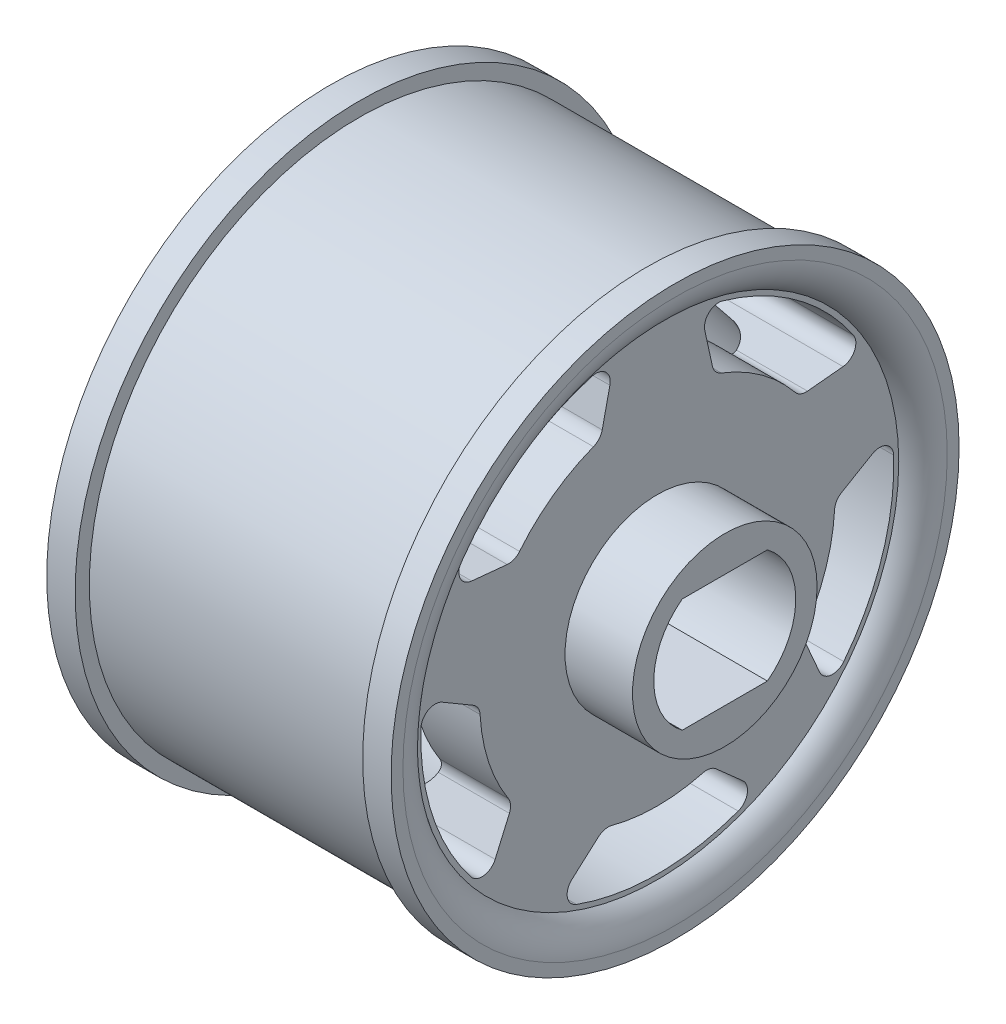
from build123d import *

# Parameters (mm, degrees)
CUT_EXTRUDE1_DEPTH      = 40.624014183
CUT_EXTRUDE2_DEPTH      = 34.660993746
CUT_EXTRUDE2_DEPTH_BACK = 34.660993746
FILLET2_R               = 1


with BuildPart() as part:
    # Sketch1 → Revolve1 (revolve)
    with BuildSketch(Plane(origin=(0, 0, 0), x_dir=(1, 0, 0), z_dir=(0, 1, 0))):
        Polygon((0, 0), (0, 6.5), (-4.75, 6.5), (-4.75, 17), (-3.5, 17), (-3.5, 20), (-5.5, 20), (-5.5, 19), (-25.75, 19), (-25.75, 20), (-27.75, 20), (-27.75, 17), (-9.5, 14), (-9.5, 0), align=None)
    revolve(axis=Axis((0, 0, 0), (-1, 0, 0)))

    # Fillet1: read off the stored shape, not the designer's step
    # Fillet1 outline → Fillet1 (revolve, cut)
    with BuildSketch(Plane.YX):
        with BuildLine():
            Line((16.655701343, -25.655516501), (16.655701343, -27.75))
            Line((16.655701343, -27.75), (19.122593389, -27.75))
            ThreePointArc((19.122593389, -27.75), (17.50453765, -27.155753296), (16.655701343, -25.655516501))
        make_face()
        with BuildLine():
            Line((17, -3.5), (17, -4.75))
            ThreePointArc((17, -4.75), (17.915063509, -3.834936491), (19.165063509, -3.5))
            Line((19.165063509, -3.5), (17, -3.5))
        make_face()
    revolve(axis=Axis((0, 0, 0), (1, 0, 0)), mode=Mode.SUBTRACT)

    # Fillet1 2 outline → Fillet1 2 (revolve)
    with BuildSketch(Plane.YX):
        with BuildLine():
            Line((14.344298657, -9.5), (11.877406611, -9.5))
            ThreePointArc((11.877406611, -9.5), (13.49546235, -10.094246704), (14.344298657, -11.594483499))
            Line((14.344298657, -11.594483499), (14.344298657, -9.5))
        make_face()
    revolve(axis=Axis((0, 0, 0), (1, 0, 0)))

    # Sketch2 → Cut-Extrude1 (cut, through all)
    with BuildSketch(Plane(origin=(0, 0, 0), x_dir=(0, 0, -1), z_dir=(1, 0, 0))):
        with BuildLine():
            Line((3, 4), (-3, 4))
            ThreePointArc((-3, 4), (-5, 0), (-3, -4))
            Line((-3, -4), (3, -4))
            ThreePointArc((3, -4), (5, 0), (3, 4))
        make_face()
    extrude(amount=-CUT_EXTRUDE1_DEPTH, mode=Mode.SUBTRACT)

    # Sketch3 → Cut-Extrude2 (cut, two sides: drawn at the far end of the back side and taken through both)
    with BuildSketch(Plane.ZY.offset(9.5).offset(-CUT_EXTRUDE2_DEPTH_BACK)):
        with BuildLine():
            Line((-4, 11.842719282), (-3, 16.383295981))
            ThreePointArc((-3, 16.383295981), (-9.789975616, 13.474745439), (-14.654389418, 7.915886431))
            Line((-14.654389418, 7.915886431), (-10.027027367, 7.463827583))
            ThreePointArc((-10.027027367, 7.463827583), (-7.347315654, 10.11271243), (-4, 11.842719282))
        make_face()
        with BuildLine():
            ThreePointArc((14.654389418, 7.915886431), (9.789975616, 13.474745439), (3, 16.383295981))
            Line((3, 16.383295981), (4, 11.842719282))
            ThreePointArc((4, 11.842719282), (7.347315654, 10.11271243), (10.027027367, 7.463827583))
            Line((10.027027367, 7.463827583), (14.654389418, 7.915886431))
        make_face()
        with BuildLine():
            Line((-12.499163322, -0.144624547), (-16.508491385, 2.209547333))
            ThreePointArc((-16.508491385, 2.209547333), (-15.840513295, -5.146894768), (-12.056910745, -11.491009116))
            Line((-12.056910745, -11.491009116), (-10.197043719, -7.22982015))
            ThreePointArc((-10.197043719, -7.22982015), (-11.888206454, -3.86271243), (-12.499163322, -0.144624547))
        make_face()
        with BuildLine():
            Line((-3.724907764, -11.932102168), (-7.202808779, -15.01772063))
            ThreePointArc((-7.202808779, -15.01772063), (0, -16.655701343), (7.202808779, -15.01772063))
            Line((7.202808779, -15.01772063), (3.724907764, -11.932102168))
            ThreePointArc((3.724907764, -11.932102168), (0, -12.5), (-3.724907764, -11.932102168))
        make_face()
        with BuildLine():
            ThreePointArc((16.655701343, 0), (16.618858104, 1.107222899), (16.508491385, 2.209547333))
            Line((16.508491385, 2.209547333), (12.499163322, -0.144624547))
            ThreePointArc((12.499163322, -0.144624547), (11.888206454, -3.86271243), (10.197043719, -7.22982015))
            Line((10.197043719, -7.22982015), (12.056910745, -11.491009116))
            ThreePointArc((12.056910745, -11.491009116), (15.463322601, -6.188541134), (16.655701343, 0))
        make_face()
    extrude(amount=CUT_EXTRUDE2_DEPTH + CUT_EXTRUDE2_DEPTH_BACK, mode=Mode.SUBTRACT)

    # Fillet2
    fillet2_edges = [part.edges().sort_by_distance(p)[0] for p in [
        (-7.16438265, -0.144624547, 12.499163322),
        (-15.20275825, 2.209547333, 16.508491385),
        (-15.20275825, -11.491009116, 12.056910745),
        (-7.16438265, -7.22982015, 10.197043719),
        (-7.16438265, -7.22982015, -10.197043719),
        (-15.20275825, -11.491009116, -12.056910745),
        (-7.16438265, -0.144624547, -12.499163322),
        (-7.16438265, 7.463827583, -10.027027367),
        (-15.20275825, 7.915886431, -14.654389418),
        (-15.20275825, 16.383295981, -3),
        (-7.16438265, 11.842719282, -4),
        (-7.16438265, 11.842719282, 4),
        (-15.20275825, 16.383295981, 3),
        (-15.20275825, 7.915886431, 14.654389418),
        (-7.16438265, 7.463827583, 10.027027367),
        (-7.16438265, -11.932102168, 3.724907764),
        (-15.20275825, -15.01772063, 7.202808779),
        (-15.20275825, -15.01772063, -7.202808779),
        (-7.16438265, -11.932102168, -3.724907764),
        (-15.20275825, 2.209547333, -16.508491385),
    ]]
    fillet(fillet2_edges, radius=FILLET2_R)


solid = part.part
